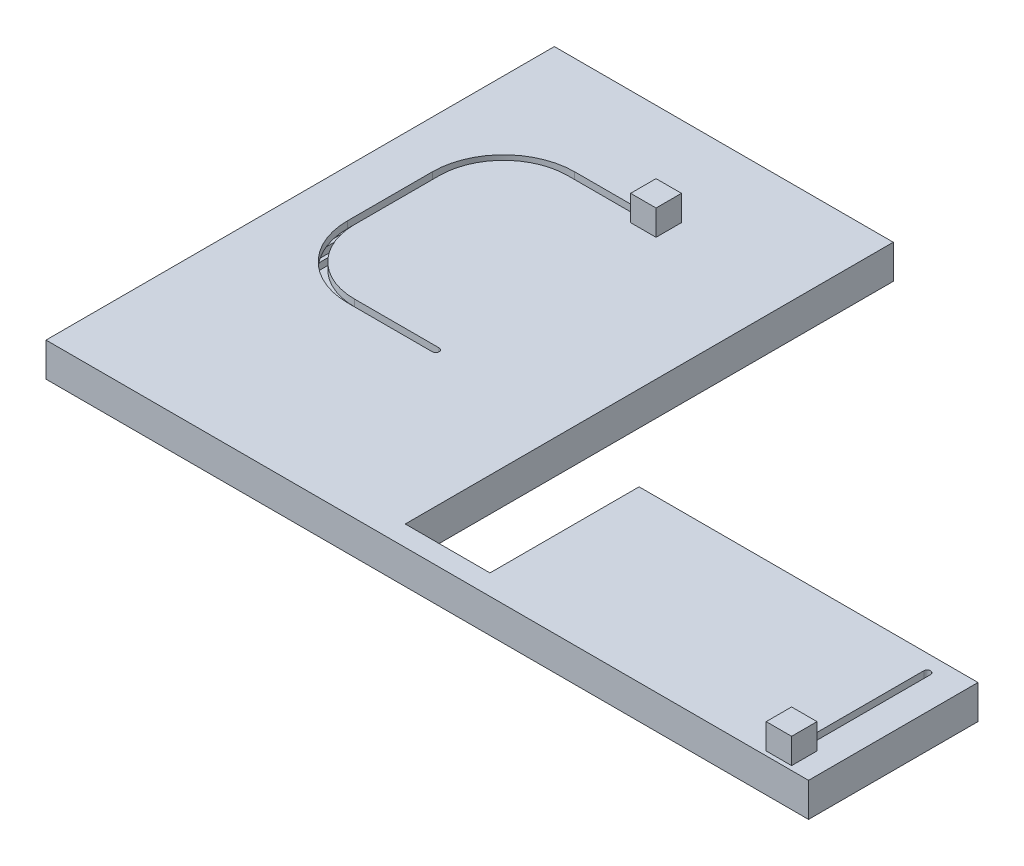
from build123d import *

# Parameters (mm, degrees)
BOSS_EXTRUDE1_DEPTH       = 4
SKETCH3_3_R               = 2
BOSS_EXTRUDE2_DEPTH       = 4
BOSS_EXTRUDE3_DEPTH       = 2
BOSS_EXTRUDE4_START       = 4
SKETCH3_5_W               = 15
SKETCH3_5_H               = 15
BOSS_EXTRUDE4_DEPTH       = 15
BOSS_EXTRUDE5_DEPTH       = 4
BOSS_EXTRUDE6_DEPTH       = 4
SKETCH6_R                 = 2
BOSS_EXTRUDE7_DEPTH       = 10
BOSS_EXTRUDE8_START       = -4
SKETCH6_3_R               = 2
BOSS_EXTRUDE8_DEPTH       = 2
BOSS_EXTRUDE9_DEPTH       = 4
SKETCH8_R                 = 2
BOSS_EXTRUDE10_DEPTH      = 8
BOSS_EXTRUDE11_DEPTH      = 4
BOSS_EXTRUDE12_START      = 4
SKETCH9_3_W               = 15
SKETCH9_3_H               = 15
BOSS_EXTRUDE12_DEPTH      = 15
SKETCH10_R                = 2
BOSS_EXTRUDE13_DEPTH      = 10
BOSS_EXTRUDE14_START      = -10
BOSS_EXTRUDE14_DEPTH      = 4
BOSS_EXTRUDE15_DEPTH      = 4
BOSS_EXTRUDE15_DEPTH_BACK = 16
SHELL8_START              = -198
SHELL8_OUTLINE_W          = 16
SHELL8_OUTLINE_H          = 296
SHELL8_DEPTH              = 196
SHELL8_START_2            = 52
SHELL8_2_OUTLINE_W        = 16
SHELL8_2_OUTLINE_H        = 96
SHELL8_2_DEPTH            = 196
SHELL8_START_3            = -2
SHELL8_3_OUTLINE_W        = 16
SHELL8_3_OUTLINE_H        = 8
SHELL8_3_DEPTH            = 54
BOSS_EXTRUDE16_DEPTH      = 4
BOSS_EXTRUDE17_START      = -16
BOSS_EXTRUDE17_DEPTH      = 4
CUT_EXTRUDE1_DEPTH        = 4
INDENT1_START             = -14
INDENT1_OUTLINE_R         = 2
INDENT1_DEPTH             = 16
CUT_EXTRUDE2_DEPTH        = 2


# Read off the part's stored shape, not the designer's step: Shell8, Indent1
with BuildPart() as part:
    # Sketch3 → Boss-Extrude1 (new body)
    with BuildSketch(Plane(origin=(0, 0, 0), x_dir=(1, 0, 0), z_dir=(0, 1, 0))):
        with BuildLine():
            Line((222.5, -6), (222.5, -4))
            Line((222.5, -4), (68.116930232, -4))
            ThreePointArc((68.116930232, -4), (66.116930232, -2), (68.116930232, 0))
            Line((68.116930232, 0), (222.5, 0))
            Line((222.5, 0), (222.5, 2))
            Line((222.5, 2), (68.116930232, 2))
            ThreePointArc((68.116930232, 2), (64.116930232, -2), (68.116930232, -6))
            Line((68.116930232, -6), (222.5, -6))
        make_face()
        with BuildLine():
            Line((230, -4), (228, -4))
            Line((228, -4), (222.5, -4))
            Line((222.5, -4), (222.5, -6))
            Line((222.5, -6), (230, -6))
            ThreePointArc((230, -6), (234, -2), (230, 2))
            Line((230, 2), (222.5, 2))
            Line((222.5, 2), (222.5, 0))
            Line((222.5, 0), (228, 0))
            Line((228, 0), (230, 0))
            Line((230, 0), (232, 0))
            Line((232, 0), (232, -2))
            Line((232, -2), (232, -4))
            Line((232, -4), (230, -4))
        make_face()
        with BuildLine():
            ThreePointArc((232, -2), (231.414213562, -3.414213562), (230, -4))
            Line((230, -4), (232, -4))
            Line((232, -4), (232, -2))
        make_face()
        with BuildLine():
            Line((232, 0), (230, 0))
            ThreePointArc((230, 0), (231.414213562, -0.585786438), (232, -2))
            Line((232, -2), (232, 0))
        make_face()
    extrude(amount=-BOSS_EXTRUDE1_DEPTH)



with BuildPart() as body_2:
    # Sketch3<3> → Boss-Extrude2 (new body)
    with BuildSketch(Plane(origin=(0, 0, 0), x_dir=(1, 0, 0), z_dir=(0, 1, 0))):
        with Locations(Location((230, -2, 0), (0, 0, 270))):
            Circle(SKETCH3_3_R)
    extrude(amount=BOSS_EXTRUDE2_DEPTH)


with BuildPart() as part_1:
    add(part.part)

    add(body_2.part)  # Boss-Extrude3 merges body 2
    # Sketch3<4> → Boss-Extrude3 (add)
    with BuildSketch(Plane(origin=(0, 0, 0), x_dir=(1, 0, 0), z_dir=(0, 1, 0))):
        with BuildLine():
            Line((228, -4), (230, -4))
            ThreePointArc((230, -4), (232, -2), (230, 0))
            Line((230, 0), (228, 0))
            Line((228, 0), (228, -2))
            Line((228, -2), (228, -4))
        make_face()
    extrude(amount=-BOSS_EXTRUDE3_DEPTH)

    # Sketch3<5> → Boss-Extrude4 (add)
    with BuildSketch(Plane(origin=(0, 0, 0), x_dir=(1, 0, 0), z_dir=(0, 1, 0)).offset(BOSS_EXTRUDE4_START)):
        with Locations((230, -2)):
            Rectangle(SKETCH3_5_W, SKETCH3_5_H)
    extrude(amount=BOSS_EXTRUDE4_DEPTH)


with BuildPart() as body_2_2:
    # Sketch4 → Boss-Extrude5 (new body)
    with BuildSketch(Plane.XZ.offset(4)):
        with BuildLine():
            Line((72.116930232, -78), (72.116930232, 10))
            Line((72.116930232, 10), (-9.06494743, 10))
            Line((-9.06494743, 10), (-174.948017199, 10))
            Line((-174.948017199, 10), (-174.948017199, -88.136351977))
            Line((-174.948017199, -88.136351977), (-174.948017199, -148.837066579))
            ThreePointArc((-174.948017199, -148.837066579), (-170.948017199, -152.837066579), (-166.948017199, -148.837066579))
            Line((-166.948017199, -148.837066579), (-166.948017199, -88.136351977))
            Line((-166.948017199, -88.136351977), (-166.948017199, 2))
            Line((-166.948017199, 2), (-9.06494743, 2))
            Line((-9.06494743, 2), (64.116930232, 2))
            Line((64.116930232, 2), (64.116930232, -78))
            ThreePointArc((64.116930232, -78), (68.116930232, -82), (72.116930232, -78))
        make_face()
        with BuildLine():
            Line((-168.948017199, -148.837066579), (-168.948017199, -88.136351977))
            ThreePointArc((-168.948017199, -88.136351977), (-170.948017199, -86.136351977), (-172.948017199, -88.136351977))
            Line((-172.948017199, -88.136351977), (-172.948017199, -148.837066579))
            ThreePointArc((-172.948017199, -148.837066579), (-170.948017199, -150.837066579), (-168.948017199, -148.837066579))
        make_face(mode=Mode.SUBTRACT)
        with BuildLine():
            Line((70.116930232, -78), (70.116930232, 6))
            ThreePointArc((70.116930232, 6), (68.116930232, 8), (66.116930232, 6))
            Line((66.116930232, 6), (66.116930232, -78))
            ThreePointArc((66.116930232, -78), (68.116930232, -80), (70.116930232, -78))
        make_face(mode=Mode.SUBTRACT)
    extrude(amount=BOSS_EXTRUDE5_DEPTH)


with BuildPart() as body_3:
    # Sketch5 → Boss-Extrude6 (new body)
    with BuildSketch(Plane.XZ.offset(8)):
        with BuildLine():
            Line((-8.71632446, -159.015221208), (-83.295093699, -152.490424359))
            Line((-83.295093699, -152.490424359), (-170.599394228, -144.852287786))
            ThreePointArc((-170.599394228, -144.852287786), (-174.932795991, -148.488443608), (-171.29664017, -152.821845371))
            Line((-171.29664017, -152.821845371), (-83.992339641, -160.459981944))
            Line((-83.992339641, -160.459981944), (-9.413570401, -166.984778792))
            ThreePointArc((-9.413570401, -166.984778792), (-5.080168638, -163.348622971), (-8.71632446, -159.015221208))
        make_face()
        with BuildLine():
            Line((-83.469405185, -154.482813756), (-170.773705713, -146.844677182))
            ThreePointArc((-170.773705713, -146.844677182), (-172.940406595, -148.662755093), (-171.122328684, -150.829455975))
            Line((-171.122328684, -150.829455975), (-83.818028156, -158.467592548))
            ThreePointArc((-83.818028156, -158.467592548), (-81.651327274, -156.649514637), (-83.469405185, -154.482813756))
        make_face(mode=Mode.SUBTRACT)
    extrude(amount=BOSS_EXTRUDE6_DEPTH)

    # Sketch6 → Boss-Extrude7 (add)
    with BuildSketch(Plane(origin=(0, -8, 0), x_dir=(1, 0, 0), z_dir=(0, 1, 0))):
        with Locations(Location((-9.06494743, 163, 0), (0, 0, 270))):
            Circle(SKETCH6_R)
    extrude(amount=BOSS_EXTRUDE7_DEPTH)

    # Sketch6<3> → Boss-Extrude8 (add)
    with BuildSketch(Plane(origin=(0, -8, 0), x_dir=(1, 0, 0), z_dir=(0, 1, 0)).offset(BOSS_EXTRUDE8_START)):
        with Locations(Location((-9.06494743, 163, 0), (0, 0, 270))):
            Circle(SKETCH6_3_R)
    extrude(amount=-BOSS_EXTRUDE8_DEPTH)

    # Sketch7 → Boss-Extrude9 (add)
    with BuildSketch(Plane(origin=(0, -4, 0), x_dir=(1, 0, 0), z_dir=(0, 1, 0))):
        with BuildLine():
            Line((-6.3625866, 165.949109347), (-77.29763917, 230.949109347))
            Line((-77.29763917, 230.949109347), (-126.901571386, 276.402738791))
            ThreePointArc((-126.901571386, 276.402738791), (-132.553041564, 276.155990274), (-132.306293047, 270.504520097))
            Line((-132.306293047, 270.504520097), (-82.70236083, 225.050890653))
            Line((-82.70236083, 225.050890653), (-11.767308261, 160.050890653))
            ThreePointArc((-11.767308261, 160.050890653), (-6.115838083, 160.29763917), (-6.3625866, 165.949109347))
        make_face()
        with BuildLine():
            Line((-78.648819585, 229.474554674), (-128.252751801, 274.928184118))
            ThreePointArc((-128.252751801, 274.928184118), (-131.07848689, 274.804809859), (-130.955112632, 271.97907477))
            Line((-130.955112632, 271.97907477), (-81.351180415, 226.525445326))
            ThreePointArc((-81.351180415, 226.525445326), (-78.525445326, 226.648819585), (-78.648819585, 229.474554674))
        make_face(mode=Mode.SUBTRACT)
    extrude(amount=BOSS_EXTRUDE9_DEPTH)


with BuildPart() as body_4:
    # Sketch8 → Boss-Extrude10 (new body)
    with BuildSketch(Plane(origin=(0, -4, 0), x_dir=(1, 0, 0), z_dir=(0, 1, 0))):
        with Locations(Location((-170.948017199, 148.837066579, 0), (0, 0, 270))):
            Circle(SKETCH8_R)
    extrude(amount=-BOSS_EXTRUDE10_DEPTH)


with BuildPart() as body_5:
    # Sketch9 → Boss-Extrude11 (new, symmetric)
    with BuildSketch(Plane(origin=(0, 0, 0), x_dir=(1, 0, 0), z_dir=(0, 1, 0))):
        with BuildLine():
            ThreePointArc((-81.351180415, 226.525445326), (-79.19450662, 226.169377042), (-78, 228))
            ThreePointArc((-78, 228), (-78.169377042, 228.80549338), (-78.648819585, 229.474554674))
            ThreePointArc((-78.648819585, 229.474554674), (-81.474554674, 229.351180415), (-81.351180415, 226.525445326))
        make_face()
    extrude(amount=BOSS_EXTRUDE11_DEPTH, both=True)

    # Sketch9<3> → Boss-Extrude12 (add)
    with BuildSketch(Plane(origin=(0, 0, 0), x_dir=(1, 0, 0), z_dir=(0, 1, 0)).offset(BOSS_EXTRUDE12_START)):
        with Locations((-80, 228)):
            Rectangle(SKETCH9_3_W, SKETCH9_3_H)
    extrude(amount=BOSS_EXTRUDE12_DEPTH)


with BuildPart() as body_6:
    # Sketch10 → Boss-Extrude13 (new body)
    with BuildSketch(Plane(origin=(0, 0, 0), x_dir=(1, 0, 0), z_dir=(0, 1, 0))):
        with Locations(Location((68.116930232, -2, 0), (0, 0, 270))):
            Circle(SKETCH10_R)
    extrude(amount=-BOSS_EXTRUDE13_DEPTH)

    # Sketch10<3> → Boss-Extrude14 (add)
    with BuildSketch(Plane(origin=(0, 0, 0), x_dir=(1, 0, 0), z_dir=(0, 1, 0)).offset(BOSS_EXTRUDE14_START)):
        Polygon((67.209998713, -4.67908104), (70.796011272, -2.906931518), (69.02386175, 0.67908104), (65.437849192, -1.093068482), align=None)
    extrude(amount=-BOSS_EXTRUDE14_DEPTH)


with BuildPart() as body_7:
    # Sketch1 → Boss-Extrude15 (new, two sides: drawn at the far end of the back side and taken through both)
    with BuildSketch(Plane(origin=(0, 0, 0), x_dir=(1, 0, 0), z_dir=(0, 1, 0)).offset(-BOSS_EXTRUDE15_DEPTH_BACK)):
        Polygon((0, 0), (0, 288), (-200, 288), (-200, -12), (250, -12), (250, 88), (50, 88), (50, 0), align=None)
    extrude(amount=BOSS_EXTRUDE15_DEPTH + BOSS_EXTRUDE15_DEPTH_BACK)

    # Shell8 outline → Shell8 (cut)
    with BuildSketch(Plane.YZ.offset(SHELL8_START)):
        with Locations((-6, -138)):
            Rectangle(SHELL8_OUTLINE_W, SHELL8_OUTLINE_H)
    extrude(amount=SHELL8_DEPTH, mode=Mode.SUBTRACT)

    # Shell8 2 outline → Shell8 2 (cut)
    with BuildSketch(Plane.YZ.offset(SHELL8_START_2)):
        with Locations((-6, -38)):
            Rectangle(SHELL8_2_OUTLINE_W, SHELL8_2_OUTLINE_H)
    extrude(amount=SHELL8_2_DEPTH, mode=Mode.SUBTRACT)

    # Shell8 3 outline → Shell8 3 (cut)
    with BuildSketch(Plane.YZ.offset(SHELL8_START_3)):
        with Locations((-6, 6)):
            Rectangle(SHELL8_3_OUTLINE_W, SHELL8_3_OUTLINE_H)
    extrude(amount=SHELL8_3_DEPTH, mode=Mode.SUBTRACT)

    # Sketch1<3> → Boss-Extrude16 (add)
    with BuildSketch(Plane(origin=(0, 0, 0), x_dir=(1, 0, 0), z_dir=(0, 1, 0))):
        Polygon((0, 0), (0, 288), (-200, 288), (-200, -12), (250, -12), (250, 88), (50, 88), (50, 0), align=None)
    extrude(amount=BOSS_EXTRUDE16_DEPTH)

    # Sketch1<4> → Boss-Extrude17 (add)
    with BuildSketch(Plane(origin=(0, 0, 0), x_dir=(1, 0, 0), z_dir=(0, 1, 0)).offset(BOSS_EXTRUDE17_START)):
        Polygon((0, 0), (0, 288), (-200, 288), (-200, -12), (250, -12), (250, 88), (50, 88), (50, 0), align=None)
    extrude(amount=BOSS_EXTRUDE17_DEPTH)

    # Sketch11 → Cut-Extrude1 (cut)
    with BuildSketch(Plane(origin=(0, 4, 0), x_dir=(1, 0, 0), z_dir=(0, 1, 0))):
        with BuildLine():
            Line((-80, 230), (-130, 230))
            ThreePointArc((-130, 230), (-159.69848481, 217.69848481), (-172, 188))
            Line((-172, 188), (-172, 138))
            ThreePointArc((-172, 138), (-159.69848481, 108.30151519), (-130, 96))
            Line((-130, 96), (-80, 96))
            ThreePointArc((-80, 96), (-78, 98), (-80, 100))
            Line((-80, 100), (-130, 100))
            ThreePointArc((-130, 100), (-156.870057685, 111.129942315), (-168, 138))
            Line((-168, 138), (-168, 188))
            ThreePointArc((-168, 188), (-156.870057685, 214.870057685), (-130, 226))
            Line((-130, 226), (-80, 226))
            ThreePointArc((-80, 226), (-78, 228), (-80, 230))
        make_face()
        with BuildLine():
            Line((228, 78), (228, -2))
            ThreePointArc((228, -2), (230, -4), (232, -2))
            Line((232, -2), (232, 78))
            ThreePointArc((232, 78), (230, 80), (228, 78))
        make_face()
    extrude(amount=-CUT_EXTRUDE1_DEPTH, mode=Mode.SUBTRACT)

    # Indent1 outline → Indent1 (cut)
    with BuildSketch(Plane(origin=(0, 0, 0), x_dir=(1, 0, 0), z_dir=(0, 1, 0)).offset(INDENT1_START)):
        with Locations((-9.06494743, 163)):
            Circle(INDENT1_OUTLINE_R)
    extrude(amount=INDENT1_DEPTH, mode=Mode.SUBTRACT)

    # Sketch13 → Cut-Extrude2 (cut)
    with BuildSketch(Plane(origin=(0, -12, 0), x_dir=(1, 0, 0), z_dir=(0, 1, 0))):
        Polygon((232.67908104, 77.093068482), (230.906931518, 80.67908104), (227.32091896, 78.906931518), (229.093068482, 75.32091896), align=None)
        Polygon((70.796011272, -2.906931518), (69.02386175, 0.67908104), (67.230855471, -0.206993721), (65.437849192, -1.093068482), (67.209998713, -4.67908104), (69.003004993, -3.793006279), align=None)
        Polygon((229.093068482, 75.32091896), (227.32091896, 78.906931518), (69.02386175, 0.67908104), (70.796011272, -2.906931518), align=None)
    extrude(amount=-CUT_EXTRUDE2_DEPTH, mode=Mode.SUBTRACT)


solid = Compound([part_1.part, body_2_2.part, body_3.part, body_4.part, body_5.part, body_6.part, body_7.part])
